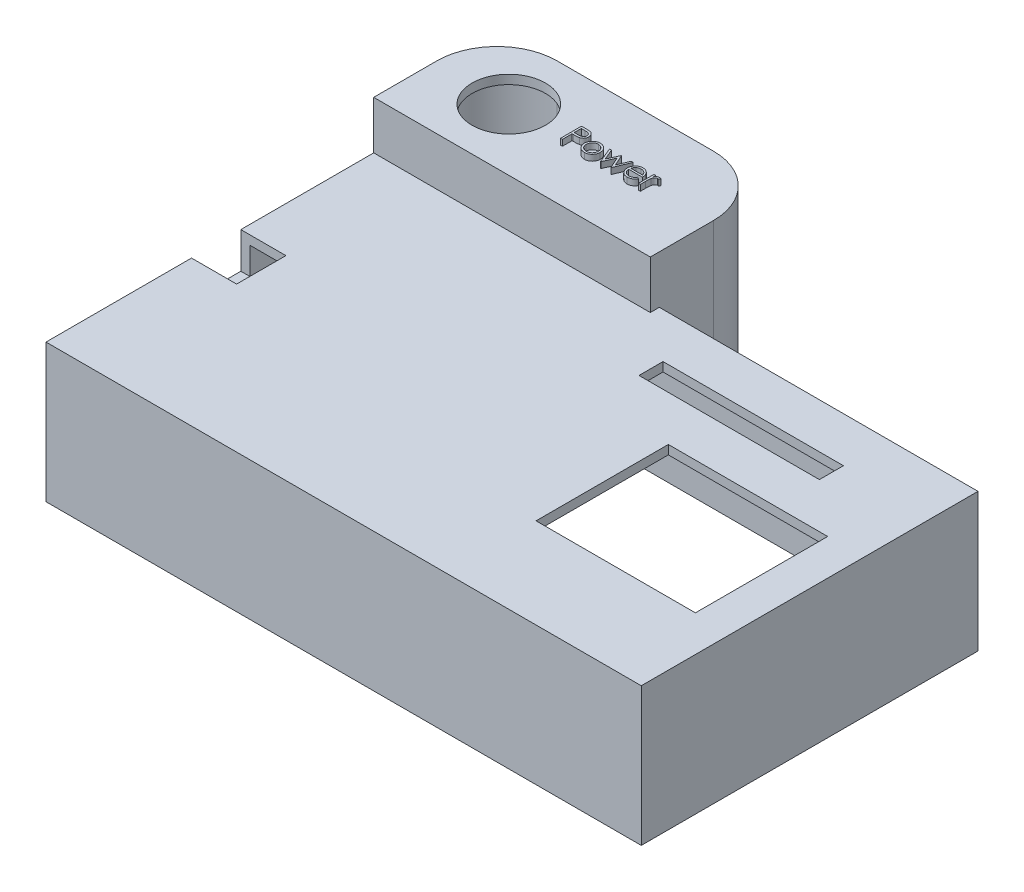
from build123d import *

# Parameters (mm, degrees)
SKETCH1_W           = 99
SKETCH1_H           = 56
BOSS_EXTRUDE1_DEPTH = 23
SKETCH3_W           = 96
SKETCH3_H           = 53
CUT_EXTRUDE1_DEPTH  = 21.5
SKETCH4_W           = 7.5
SKETCH4_H           = 8.2
CUT_EXTRUDE4_DEPTH  = 6
BOSS_EXTRUDE5_DEPTH = 31
CUT_EXTRUDE8_DEPTH  = 29.5
SKETCH16_W          = 37.752580564
SKETCH16_H          = 16
CUT_EXTRUDE10_DEPTH = 2
SKETCH17_R          = 6.1
CUT_EXTRUDE11_DEPTH = 2
BOSS_EXTRUDE6_DEPTH = 1
SKETCH19_W          = 26.5
SKETCH19_H          = 22
CUT_EXTRUDE12_DEPTH = 2
SKETCH20_W          = 30
SKETCH20_H          = 4
CUT_EXTRUDE13_DEPTH = 2


with BuildPart() as part:
    # Sketch1 → Boss-Extrude1 (new body)
    with BuildSketch(Plane(origin=(0, 0, 0), x_dir=(1, 0, 0), z_dir=(0, 1, 0))):
        Rectangle(SKETCH1_W, SKETCH1_H)
    extrude(amount=BOSS_EXTRUDE1_DEPTH)

    # Sketch3 → Cut-Extrude1 (cut)
    with BuildSketch(Plane.XZ):
        Rectangle(SKETCH3_W, SKETCH3_H)
    extrude(amount=-CUT_EXTRUDE1_DEPTH, mode=Mode.SUBTRACT)

    # Sketch4 → Cut-Extrude4 (cut)
    with BuildSketch(Plane(origin=(0, 23, 0), x_dir=(1, 0, 0), z_dir=(0, 1, 0))):
        with Locations((-45.75, 0.3)):
            Rectangle(SKETCH4_W, SKETCH4_H)
    extrude(amount=-CUT_EXTRUDE4_DEPTH, mode=Mode.SUBTRACT)

    # Sketch9 → Boss-Extrude5 (add)
    with BuildSketch(Plane.XZ):
        with BuildLine():
            Line((-3.5, -26.5), (-49.5, -26.5))
            Line((-49.5, -26.5), (-49.5, -37))
            ThreePointArc((-49.5, -37), (-46.571067812, -44.071067812), (-39.5, -47))
            Line((-39.5, -47), (-13.5, -47))
            ThreePointArc((-13.5, -47), (-6.428932188, -44.071067812), (-3.5, -37))
            Line((-3.5, -37), (-3.5, -26.5))
        make_face()
    extrude(amount=-BOSS_EXTRUDE5_DEPTH)

    # Sketch14 → Cut-Extrude8 (cut)
    with BuildSketch(Plane(origin=(0, 0, 0), x_dir=(-1, 0, 0), z_dir=(0, -1, 0))):
        with BuildLine():
            Line((5, 28), (48, 28))
            Line((48, 28), (48, 35.5))
            ThreePointArc((48, 35.5), (45.071067812, 42.571067812), (38, 45.5))
            Line((38, 45.5), (15, 45.5))
            ThreePointArc((15, 45.5), (7.928932188, 42.571067812), (5, 35.5))
            Line((5, 35.5), (5, 28))
        make_face()
    extrude(amount=-CUT_EXTRUDE8_DEPTH, mode=Mode.SUBTRACT)

    # Sketch16 → Cut-Extrude10 (cut)
    with BuildSketch(Plane.XY.offset(-26.5)):
        with Locations((-27.111178413, 12)):
            Rectangle(SKETCH16_W, SKETCH16_H)
    extrude(amount=-CUT_EXTRUDE10_DEPTH, mode=Mode.SUBTRACT)

    # Sketch17 → Cut-Extrude11 (cut)
    with BuildSketch(Plane(origin=(0, 29.5, 0), x_dir=(-1, 0, 0), z_dir=(0, -1, 0))):
        with Locations((37.281553398, 36.75)):
            Circle(SKETCH17_R)
    extrude(amount=-CUT_EXTRUDE11_DEPTH, mode=Mode.SUBTRACT)

    # Sketch18 → Boss-Extrude6 (add)
    # profile 1 of 5: a face of its own
    with BuildSketch(Plane(origin=(0, 31, 0), x_dir=(1, 0, 0), z_dir=(0, 1, 0))):
        with BuildLine():
            Line((-27.068619083, 38.631067961), (-26.382220846, 38.631067961))
            add(Edge.make_bspline(
                [(-26.382220846, 38.631067961), (-26.33500994, 38.631016065), (-26.244551747, 38.630916629), (-26.114836691, 38.627901884), (-25.99702696, 38.623875192), (-25.891376579, 38.618293298), (-25.797560481, 38.611696708), (-25.716003181, 38.602444669), (-25.646063625, 38.592784373), (-25.604157175, 38.582962967), (-25.585045365, 38.578483827)],
                knots=[0, 0, 0, 0, 1.415646017, 2.712440637, 3.8905458, 4.950247383, 5.884950622, 6.709939814, 7.411656543, 8, 8, 8, 8], degree=3))
            add(Edge.make_bspline(
                [(-25.585045365, 38.578483827), (-25.560851831, 38.571861877), (-25.513034854, 38.558774015), (-25.444133811, 38.532560292), (-25.378579966, 38.501478126), (-25.316148407, 38.466054187), (-25.257606324, 38.424768622), (-25.202080283, 38.379295005), (-25.150060303, 38.328583436), (-25.101838911, 38.273202696), (-25.057554113, 38.214082486), (-25.019424431, 38.150340256), (-24.987497204, 38.083048953), (-24.960113932, 38.012255382), (-24.940405478, 37.937365058), (-24.925558578, 37.858898346), (-24.91613495, 37.776863656), (-24.915232389, 37.720803788), (-24.914772929, 37.692265878)],
                knots=[0, 0, 0, 0, 0.999701418, 1.975846123, 2.934577507, 3.890451536, 4.834027766, 5.787354733, 6.749476667, 7.726910423, 8.712836071, 9.690891519, 10.682875813, 11.679750201, 12.712814741, 13.765529915, 14.8625177, 16, 16, 16, 16], degree=3))
            add(Edge.make_bspline(
                [(-24.914772929, 37.692265878), (-24.915194354, 37.663488101), (-24.9160189, 37.607182437), (-24.925915185, 37.524809649), (-24.939245377, 37.446091259), (-24.959742429, 37.371201808), (-24.986588102, 37.300586038), (-25.018080155, 37.233164806), (-25.056063686, 37.170085134), (-25.099708515, 37.111118016), (-25.14826011, 37.056208104), (-25.201513048, 37.00575331), (-25.25925234, 36.960048971), (-25.321294488, 36.918992627), (-25.388244337, 36.883536348), (-25.459086491, 36.851779043), (-25.534436707, 36.825107982), (-25.586579221, 36.811077921), (-25.613090237, 36.803944564)],
                knots=[0, 0, 0, 0, 1.121902311, 2.195077645, 3.232258892, 4.234102512, 5.217864754, 6.176164875, 7.132989551, 8.084763148, 9.034132444, 9.988522005, 10.94243251, 11.903244335, 12.886203696, 13.894208494, 14.929344452, 16, 16, 16, 16], degree=3))
            add(Edge.make_bspline(
                [(-25.613090237, 36.803944564), (-25.635017571, 36.799281583), (-25.683072598, 36.789062388), (-25.762215321, 36.777653932), (-25.854360706, 36.767916331), (-25.959382986, 36.760615193), (-26.077187891, 36.754364825), (-26.207839149, 36.749396731), (-26.351593226, 36.746666877), (-26.45186447, 36.746526084), (-26.504216038, 36.746452577)],
                knots=[0, 0, 0, 0, 0.601384939, 1.31797006, 2.144135048, 3.087295005, 4.142315834, 5.309527816, 6.595305764, 8, 8, 8, 8], degree=3))
            Line((-26.504216038, 36.746452577), (-26.754516519, 36.746452577))
            Line((-26.754516519, 36.746452577), (-26.754516519, 35.131067961))
            Line((-26.754516519, 35.131067961), (-27.068619083, 35.131067961))
            Line((-27.068619083, 35.131067961), (-27.068619083, 38.631067961))
        make_face()
        with BuildLine():
            Line((-26.754516519, 38.272093602), (-26.754516519, 37.105426936))
            Line((-26.754516519, 37.105426936), (-26.14173607, 37.097714596))
            add(Edge.make_bspline(
                [(-26.14173607, 37.097714596), (-26.111816145, 37.097699132), (-26.054056345, 37.09766928), (-25.970620121, 37.101654504), (-25.893210834, 37.106255036), (-25.822066259, 37.11299096), (-25.757154324, 37.122512217), (-25.698366795, 37.132123955), (-25.646159512, 37.146029318), (-25.585060311, 37.164752387), (-25.516976963, 37.196685002), (-25.442909415, 37.243034893), (-25.380138828, 37.302115601), (-25.325820532, 37.368543432), (-25.282714654, 37.442442561), (-25.251158661, 37.521511498), (-25.232617504, 37.604939348), (-25.23013131, 37.662027487), (-25.228875493, 37.690863634)],
                knots=[0, 0, 0, 0, 1.160613943, 2.240541288, 3.23993089, 4.169200891, 5.011653406, 5.7853311, 6.478053781, 7.106038997, 8.262395093, 9.384106736, 10.481365981, 11.59014053, 12.70357646, 13.786202915, 14.881775077, 16, 16, 16, 16], degree=3))
            add(Edge.make_bspline(
                [(-25.228875493, 37.690863634), (-25.23013814, 37.719002148), (-25.232648125, 37.77493803), (-25.251303988, 37.85691679), (-25.282653302, 37.935152495), (-25.326109896, 38.00812558), (-25.378851026, 38.074314384), (-25.44015037, 38.131811511), (-25.509863631, 38.178033214), (-25.574711862, 38.207866496), (-25.632313048, 38.226081771), (-25.682345008, 38.238826611), (-25.738835682, 38.249002218), (-25.801803462, 38.257241721), (-25.870760296, 38.264295182), (-25.946298611, 38.269081159), (-26.028132254, 38.271882615), (-26.084942825, 38.27202157), (-26.11439232, 38.272093602)],
                knots=[0, 0, 0, 0, 1.120700087, 2.227813068, 3.331159281, 4.466773991, 5.599788987, 6.693661531, 7.80175334, 8.91857717, 9.525282508, 10.207424825, 10.974604443, 11.810962634, 12.737642355, 13.736264703, 14.826523623, 16, 16, 16, 16], degree=3))
            Line((-26.11439232, 38.272093602), (-26.754516519, 38.272093602))
        make_face(mode=Mode.SUBTRACT)
    # profile 2 of 5: a face of its own
    with BuildSketch(Plane(origin=(0, 31, 0), x_dir=(1, 0, 0), z_dir=(0, 1, 0))):
        with BuildLine():
            add(Edge.make_bspline(
                [(-23.051191199, 37.733632064), (-23.003199926, 37.732610173), (-22.909100768, 37.730606494), (-22.771292882, 37.709191528), (-22.639747746, 37.676444164), (-22.513961554, 37.631172602), (-22.395545259, 37.570490651), (-22.282774015, 37.49808136), (-22.175957006, 37.412298766), (-22.111933976, 37.345940698), (-22.079436391, 37.312257865)],
                knots=[0, 0, 0, 0, 1.054011418, 2.066658804, 3.057071809, 4.030435133, 4.997543892, 5.974964718, 6.972108034, 8, 8, 8, 8], degree=3))
            add(Edge.make_bspline(
                [(-22.079436391, 37.312257865), (-22.051454437, 37.280043879), (-21.996032057, 37.216239337), (-21.924966338, 37.112783724), (-21.863744778, 37.005643623), (-21.814681817, 36.893396297), (-21.775996793, 36.777021626), (-21.748531097, 36.656119614), (-21.732194162, 36.530957267), (-21.729991195, 36.445953429), (-21.728875493, 36.402902897)],
                knots=[0, 0, 0, 0, 1.025258237, 2.030674902, 3.01204498, 3.988269485, 4.97094183, 5.956517959, 6.965070386, 8, 8, 8, 8], degree=3))
            add(Edge.make_bspline(
                [(-21.728875493, 36.402902897), (-21.729856831, 36.359602839), (-21.731795999, 36.274039906), (-21.750139615, 36.14802054), (-21.778670701, 36.025825718), (-21.81950254, 35.907967024), (-21.871860649, 35.794084196), (-21.935751336, 35.684674647), (-22.011622953, 35.579522514), (-22.09762695, 35.479520676), (-22.192678826, 35.387354461), (-22.295794975, 35.307026191), (-22.404949008, 35.238204667), (-22.521592362, 35.182768251), (-22.644659849, 35.139058551), (-22.774416917, 35.108358535), (-22.910661987, 35.089796851), (-23.003689208, 35.087413278), (-23.051191199, 35.086196166)],
                knots=[0, 0, 0, 0, 0.998656419, 1.973391657, 2.932242238, 3.890759089, 4.846373663, 5.82037756, 6.809684879, 7.83454468, 8.860553229, 9.859544525, 10.845671541, 11.83227036, 12.833544569, 13.85385346, 14.904124723, 16, 16, 16, 16], degree=3))
            add(Edge.make_bspline(
                [(-23.051191199, 35.086196166), (-23.098925918, 35.087417363), (-23.192416778, 35.089809137), (-23.32914276, 35.10828642), (-23.459132379, 35.139044402), (-23.582360977, 35.182911895), (-23.699505824, 35.238206439), (-23.809292321, 35.306818128), (-23.912492237, 35.387378284), (-24.007564221, 35.479514221), (-24.093562826, 35.579524177), (-24.169435835, 35.684674215), (-24.233326161, 35.794084309), (-24.285684365, 35.907966994), (-24.326516178, 36.025825726), (-24.35504727, 36.148020538), (-24.373390885, 36.274039907), (-24.375330053, 36.35960284), (-24.376311391, 36.402902897)],
                knots=[0, 0, 0, 0, 1.099876186, 2.154163076, 3.173186993, 4.173200201, 5.163417411, 6.152872554, 7.150605724, 8.17532212, 9.198891216, 10.186952605, 11.159729845, 12.11414092, 13.071450619, 14.029093627, 15.002601286, 16, 16, 16, 16], degree=3))
            add(Edge.make_bspline(
                [(-24.376311391, 36.402902897), (-24.375188081, 36.445719443), (-24.372964119, 36.530488845), (-24.35664361, 36.655415906), (-24.329285054, 36.776113295), (-24.290553657, 36.892038771), (-24.241038466, 37.003794207), (-24.180677178, 37.111199038), (-24.108886546, 37.214186839), (-24.053684594, 37.277908919), (-24.025750493, 37.3101545)],
                knots=[0, 0, 0, 0, 1.031353054, 2.041901799, 3.029428768, 4.008703097, 4.981709435, 5.96992636, 6.972712378, 8, 8, 8, 8], degree=3))
            add(Edge.make_bspline(
                [(-24.025750493, 37.3101545), (-23.993301902, 37.344129439), (-23.929486039, 37.410947135), (-23.822137311, 37.496479659), (-23.70964349, 37.570395733), (-23.589918564, 37.629871948), (-23.464235706, 37.676710466), (-23.332016463, 37.709275981), (-23.193740948, 37.730529336), (-23.099181327, 37.732587514), (-23.051191199, 37.733632064)],
                knots=[0, 0, 0, 0, 1.027980169, 2.021703884, 2.998553061, 3.971491411, 4.943284454, 5.930300938, 6.949603206, 8, 8, 8, 8], degree=3))
        make_face()
        with BuildLine():
            add(Edge.make_bspline(
                [(-23.052593442, 37.4195295), (-23.086531053, 37.418564908), (-23.153530182, 37.416660625), (-23.252149767, 37.402176721), (-23.347089921, 37.379229217), (-23.438530765, 37.34662516), (-23.526163937, 37.304526261), (-23.61007334, 37.252817901), (-23.69050578, 37.192184945), (-23.765887843, 37.122722273), (-23.835070155, 37.046843279), (-23.895548132, 36.96599492), (-23.946973238, 36.881488573), (-23.989813397, 36.793236362), (-24.021720585, 36.700343948), (-24.044893608, 36.603863317), (-24.059363848, 36.503597901), (-24.061250227, 36.435436882), (-24.062208827, 36.400799532)],
                knots=[0, 0, 0, 0, 1.021534396, 2.016698045, 2.994645724, 3.958388632, 4.93408049, 5.916473867, 6.921342795, 7.962252576, 8.998418191, 10.008913653, 10.997312074, 11.973003931, 12.956656626, 13.948281152, 14.957379055, 16, 16, 16, 16], degree=3))
            add(Edge.make_bspline(
                [(-24.062208827, 36.400799532), (-24.060602003, 36.356047505), (-24.057412759, 36.267223099), (-24.031477522, 36.136411976), (-23.988091242, 36.010830124), (-23.929503963, 35.891213738), (-23.856097744, 35.78054146), (-23.769610677, 35.681869976), (-23.670970977, 35.596684164), (-23.561354477, 35.526003319), (-23.443000159, 35.469843563), (-23.317743838, 35.430044587), (-23.187103144, 35.404172895), (-23.097822413, 35.401601421), (-23.052593442, 35.40029873)],
                knots=[0, 0, 0, 0, 1.016792936, 2.018143844, 3.017858371, 4.030088057, 5.03801393, 6.028138512, 7.003788237, 7.991172063, 8.984598303, 9.972568034, 10.972917682, 12, 12, 12, 12], degree=3))
            add(Edge.make_bspline(
                [(-23.052593442, 35.40029873), (-23.007367073, 35.401609011), (-22.918091477, 35.404195468), (-22.7876323, 35.429914287), (-22.662718329, 35.470017948), (-22.544486941, 35.525940158), (-22.434920338, 35.596952573), (-22.335571216, 35.68138895), (-22.249822605, 35.780802801), (-22.176489, 35.89136033), (-22.116942258, 36.010644682), (-22.073759056, 36.136435154), (-22.04776147, 36.267217196), (-22.044580641, 36.356045527), (-22.042978058, 36.400799532)],
                knots=[0, 0, 0, 0, 1.02726834, 2.027799167, 3.010890988, 4.004497153, 4.992059811, 5.971914811, 6.958719428, 7.966827853, 8.981595046, 9.981490638, 10.983022906, 12, 12, 12, 12], degree=3))
            add(Edge.make_bspline(
                [(-22.042978058, 36.400799532), (-22.043936328, 36.435437089), (-22.045822057, 36.503598515), (-22.060297021, 36.603860969), (-22.083452561, 36.700352565), (-22.115424178, 36.793204569), (-22.158078192, 36.881717073), (-22.210494985, 36.9657468), (-22.27072601, 37.047123346), (-22.340743131, 37.122476987), (-22.416046509, 37.192212023), (-22.496511547, 37.252841413), (-22.580296526, 37.304299008), (-22.667675109, 37.346985249), (-22.759127676, 37.378932589), (-22.853934805, 37.402309221), (-22.952133615, 37.416599417), (-23.018892658, 37.418546559), (-23.052593442, 37.4195295)],
                knots=[0, 0, 0, 0, 1.042956736, 2.052379634, 3.044323526, 4.02829302, 5.004299113, 5.996692471, 7.007513377, 8.048758398, 9.090003419, 10.095195979, 11.07790575, 12.047570684, 13.018257071, 13.989683339, 14.985167495, 16, 16, 16, 16], degree=3))
        make_face(mode=Mode.SUBTRACT)
    # profile 3 of 5: a face of its own
    with BuildSketch(Plane(origin=(0, 31, 0), x_dir=(1, 0, 0), z_dir=(0, 1, 0))):
        Polygon((-21.459644724, 37.688760269), (-21.123106263, 37.688760269), (-20.36028575, 35.849016679), (-19.526651936, 37.688760269), (-19.472665558, 37.688760269), (-18.655157545, 35.849016679), (-17.886026936, 37.688760269), (-17.55579857, 37.688760269), (-18.625009308, 35.131067961), (-18.689512513, 35.131067961), (-19.507721647, 36.970811551), (-20.341355461, 35.131067961), (-20.398847449, 35.131067961), align=None)
    # profile 4 of 5: a face of its own
    with BuildSketch(Plane(origin=(0, 31, 0), x_dir=(1, 0, 0), z_dir=(0, 1, 0))):
        with BuildLine():
            Line((-15.052793763, 35.938760269), (-14.773747288, 35.792225814))
            add(Edge.make_bspline(
                [(-14.773747288, 35.792225814), (-14.795983884, 35.752782482), (-14.839247492, 35.67604138), (-14.91364824, 35.570609519), (-14.991640313, 35.475761803), (-15.076744281, 35.394032149), (-15.166413959, 35.322780764), (-15.261146614, 35.260442939), (-15.361435432, 35.207324419), (-15.467285157, 35.162571891), (-15.579584708, 35.128162397), (-15.698606224, 35.103858176), (-15.82457772, 35.088834907), (-15.9109239, 35.087089767), (-15.955137513, 35.086196166)],
                knots=[0, 0, 0, 0, 1.120438281, 2.179929193, 3.190490725, 4.156257408, 5.095198341, 6.022838206, 6.959905092, 7.901321166, 8.864066838, 9.862729781, 10.905609505, 12, 12, 12, 12], degree=3))
            add(Edge.make_bspline(
                [(-15.955137513, 35.086196166), (-16.00427949, 35.087343342), (-16.100141252, 35.089581148), (-16.239680999, 35.108873613), (-16.371060417, 35.140345971), (-16.494272121, 35.184311513), (-16.609014373, 35.241738837), (-16.715515228, 35.311698319), (-16.814334754, 35.393830574), (-16.902358963, 35.488847017), (-16.981602846, 35.590528974), (-17.051528666, 35.696484859), (-17.109986097, 35.806448083), (-17.157538707, 35.919718607), (-17.195943572, 36.035582501), (-17.222710276, 36.155093968), (-17.238140024, 36.277929553), (-17.240504469, 36.361026888), (-17.241696006, 36.402902897)],
                knots=[0, 0, 0, 0, 1.145258523, 2.234067595, 3.276747158, 4.290159414, 5.277019952, 6.260822364, 7.254936242, 8.264827045, 9.274100331, 10.257902744, 11.220704747, 12.172965371, 13.118907548, 14.062713208, 15.023725156, 16, 16, 16, 16], degree=3))
            add(Edge.make_bspline(
                [(-17.241696006, 36.402902897), (-17.240636865, 36.442197727), (-17.238537787, 36.520074892), (-17.225306999, 36.635340437), (-17.201858706, 36.747368889), (-17.169682382, 36.856253337), (-17.128131136, 36.961811471), (-17.077298917, 37.064107535), (-17.017106539, 37.163032675), (-16.970633865, 37.225435808), (-16.947224852, 37.256869243)],
                knots=[0, 0, 0, 0, 1.024358464, 2.0301432, 3.019427413, 4.004406732, 4.986367066, 5.972626655, 6.978780325, 8, 8, 8, 8], degree=3))
            add(Edge.make_bspline(
                [(-16.947224852, 37.256869243), (-16.91551717, 37.294738113), (-16.853106223, 37.369276264), (-16.747549868, 37.46721459), (-16.633249671, 37.549258365), (-16.511638045, 37.617265501), (-16.381301571, 37.668939148), (-16.24399228, 37.70744673), (-16.098146694, 37.729024741), (-15.998441473, 37.732072575), (-15.947425173, 37.733632064)],
                knots=[0, 0, 0, 0, 1.030682036, 2.02871468, 2.997146059, 3.962720338, 4.930598197, 5.918074684, 6.934738563, 8, 8, 8, 8], degree=3))
            add(Edge.make_bspline(
                [(-15.947425173, 37.733632064), (-15.894977568, 37.732278015), (-15.792087322, 37.72962168), (-15.642055201, 37.704995346), (-15.500094484, 37.665942792), (-15.36626198, 37.610789001), (-15.240544119, 37.539629449), (-15.123758069, 37.451487608), (-15.013906557, 37.349069521), (-14.949997978, 37.270306311), (-14.917477256, 37.230226615)],
                knots=[0, 0, 0, 0, 1.056321875, 2.072262726, 3.055038591, 4.01806755, 4.982017516, 5.957941055, 6.960871419, 8, 8, 8, 8], degree=3))
            add(Edge.make_bspline(
                [(-14.917477256, 37.230226615), (-14.895350318, 37.200023034), (-14.851243725, 37.139816915), (-14.795996625, 37.041645758), (-14.74803923, 36.938935163), (-14.709706269, 36.830024866), (-14.678666768, 36.716205286), (-14.656209949, 36.596662742), (-14.64304033, 36.47143283), (-14.640451633, 36.386106275), (-14.639131904, 36.342606423)],
                knots=[0, 0, 0, 0, 0.94817472, 1.890038105, 2.849395472, 3.817997239, 4.812318967, 5.836947057, 6.897266129, 8, 8, 8, 8], degree=3))
            Line((-14.639131904, 36.342606423), (-16.927593442, 36.342606423))
            add(Edge.make_bspline(
                [(-16.927593442, 36.342606423), (-16.926053836, 36.308905958), (-16.923026262, 36.242635355), (-16.908911119, 36.145664572), (-16.886662345, 36.053291229), (-16.855393282, 35.966208187), (-16.817526437, 35.88327806), (-16.77114072, 35.805116023), (-16.715801166, 35.732078093), (-16.654075467, 35.663510955), (-16.585368371, 35.602450194), (-16.513085624, 35.547798418), (-16.436192059, 35.501992821), (-16.355293976, 35.464812931), (-16.270522191, 35.435706615), (-16.181849996, 35.415838795), (-16.089451879, 35.402531688), (-16.026466145, 35.401052023), (-15.994400333, 35.40029873)],
                knots=[0, 0, 0, 0, 1.094153842, 2.151609401, 3.174256925, 4.172055639, 5.149267565, 6.128595816, 7.11444997, 8.118368179, 9.117203808, 10.09244225, 11.054858984, 12.015122123, 12.976791628, 13.957293641, 14.960065497, 16, 16, 16, 16], degree=3))
            add(Edge.make_bspline(
                [(-15.994400333, 35.40029873), (-15.963049186, 35.400906787), (-15.900842495, 35.402113288), (-15.808201637, 35.413845199), (-15.71706211, 35.432815475), (-15.627801127, 35.458705465), (-15.542230281, 35.490282317), (-15.462984731, 35.528385174), (-15.390104515, 35.570534921), (-15.321987548, 35.618744596), (-15.255916555, 35.677752783), (-15.190374069, 35.751388504), (-15.120097415, 35.838476032), (-15.076107823, 35.904021698), (-15.052793763, 35.938760269)],
                knots=[0, 0, 0, 0, 0.99110716, 1.966546729, 2.947904876, 3.932708344, 4.903319531, 5.828989031, 6.710028674, 7.56322171, 8.463672341, 9.504779593, 10.677557249, 12, 12, 12, 12], degree=3))
        make_face()
        with BuildLine():
            add(Edge.make_bspline(
                [(-14.953234468, 36.656708987), (-14.964731092, 36.698371861), (-14.986858394, 36.778559481), (-15.033094758, 36.889600372), (-15.085166299, 36.988288273), (-15.14678803, 37.073867906), (-15.216606756, 37.149871419), (-15.297251939, 37.216290004), (-15.387687832, 37.275707455), (-15.487446973, 37.325859954), (-15.593088758, 37.368549813), (-15.70369495, 37.397174929), (-15.816552738, 37.416784471), (-15.892887024, 37.41861058), (-15.931299372, 37.4195295)],
                knots=[0, 0, 0, 0, 1.154881502, 2.222775134, 3.210006277, 4.132804581, 5.035138423, 5.962687519, 6.919655026, 7.923214229, 8.944639381, 9.960483929, 10.97369054, 12, 12, 12, 12], degree=3))
            add(Edge.make_bspline(
                [(-15.931299372, 37.4195295), (-15.96264881, 37.418917828), (-16.024620059, 37.417708682), (-16.115921127, 37.406238553), (-16.203600826, 37.387278708), (-16.288306114, 37.361313751), (-16.368926982, 37.326705149), (-16.447121751, 37.286121922), (-16.520902147, 37.236580338), (-16.567043442, 37.198821483), (-16.590353859, 37.179745846)],
                knots=[0, 0, 0, 0, 1.04873581, 2.073130211, 3.073294108, 4.04793562, 5.032784715, 6.005352987, 6.992311501, 8, 8, 8, 8], degree=3))
            add(Edge.make_bspline(
                [(-16.590353859, 37.179745846), (-16.607047141, 37.16465153), (-16.640830275, 37.134104314), (-16.685970797, 37.081475108), (-16.729191269, 37.024723545), (-16.768524922, 36.961678421), (-16.804602508, 36.893057642), (-16.838362486, 36.819440007), (-16.868748898, 36.740266876), (-16.885845008, 36.685094437), (-16.894640718, 36.656708987)],
                knots=[0, 0, 0, 0, 0.879870761, 1.780643979, 2.707998968, 3.669668524, 4.684282772, 5.740141944, 6.837334558, 8, 8, 8, 8], degree=3))
            Line((-16.894640718, 36.656708987), (-14.953234468, 36.656708987))
        make_face(mode=Mode.SUBTRACT)
    # profile 5 of 5: a face of its own
    with BuildSketch(Plane(origin=(0, 31, 0), x_dir=(1, 0, 0), z_dir=(0, 1, 0))):
        with BuildLine():
            Line((-14.100670365, 37.688760269), (-13.786567801, 37.688760269))
            Line((-13.786567801, 37.688760269), (-13.786567801, 37.312257865))
            add(Edge.make_bspline(
                [(-13.786567801, 37.312257865), (-13.763379042, 37.347313693), (-13.719030721, 37.414357693), (-13.645317792, 37.503026994), (-13.569814461, 37.57644204), (-13.492159274, 37.634945559), (-13.411781174, 37.678758678), (-13.330444222, 37.710851713), (-13.246868752, 37.729829028), (-13.190706828, 37.732362687), (-13.162569404, 37.733632064)],
                knots=[0, 0, 0, 0, 1.2804753, 2.448899062, 3.506932113, 4.484331642, 5.4025378, 6.288909075, 7.142734305, 8, 8, 8, 8], degree=3))
            add(Edge.make_bspline(
                [(-13.162569404, 37.733632064), (-13.140743077, 37.732441537), (-13.095833992, 37.729991951), (-13.027851402, 37.712781127), (-12.95780795, 37.685303104), (-12.912665563, 37.659462881), (-12.889131904, 37.645991839)],
                knots=[0, 0, 0, 0, 0.901110191, 1.854092781, 2.881294221, 4, 4, 4, 4], degree=3))
            Line((-12.889131904, 37.645991839), (-13.061607865, 37.373956583))
            add(Edge.make_bspline(
                [(-13.061607865, 37.373956583), (-13.076716886, 37.380696849), (-13.105396701, 37.393491164), (-13.147351267, 37.408633175), (-13.186032604, 37.41754909), (-13.210676162, 37.418899808), (-13.222164756, 37.4195295)],
                knots=[0, 0, 0, 0, 1.180555205, 2.24091978, 3.179933427, 4, 4, 4, 4], degree=3))
            add(Edge.make_bspline(
                [(-13.222164756, 37.4195295), (-13.24737049, 37.417849462), (-13.29878288, 37.414422673), (-13.374267379, 37.387483865), (-13.447514585, 37.343958625), (-13.505686247, 37.295687513), (-13.5507285, 37.249139716), (-13.582868725, 37.208491313), (-13.612351472, 37.162912682), (-13.640521693, 37.113182998), (-13.666187987, 37.058453152), (-13.690142656, 36.999269938), (-13.711801519, 36.93556481), (-13.724151763, 36.891182289), (-13.730478058, 36.868447769)],
                knots=[0, 0, 0, 0, 1.125678352, 2.296057538, 3.5422874, 4.923748041, 5.663163013, 6.437101912, 7.23742474, 8.08941207, 8.991984279, 9.93940061, 10.944477711, 12, 12, 12, 12], degree=3))
            add(Edge.make_bspline(
                [(-13.730478058, 36.868447769), (-13.735210451, 36.848170595), (-13.745692343, 36.803258197), (-13.75588388, 36.727909672), (-13.765953398, 36.638886013), (-13.773050017, 36.53593942), (-13.779628059, 36.419326976), (-13.783338141, 36.288871031), (-13.786441282, 36.14443768), (-13.786524349, 36.043463326), (-13.786567801, 35.990643282)],
                knots=[0, 0, 0, 0, 0.566838948, 1.255505196, 2.06880316, 3.007127437, 4.065329342, 5.249902469, 6.561414163, 8, 8, 8, 8], degree=3))
            Line((-13.786567801, 35.990643282), (-13.786567801, 35.131067961))
            Line((-13.786567801, 35.131067961), (-14.100670365, 35.131067961))
            Line((-14.100670365, 35.131067961), (-14.100670365, 37.688760269))
        make_face()
    extrude(amount=BOSS_EXTRUDE6_DEPTH)

    # Sketch19 → Cut-Extrude12 (cut)
    with BuildSketch(Plane(origin=(0, 23, 0), x_dir=(1, 0, 0), z_dir=(0, 1, 0))):
        with Locations((30.25, -2)):
            Rectangle(SKETCH19_W, SKETCH19_H)
    extrude(amount=-CUT_EXTRUDE12_DEPTH, mode=Mode.SUBTRACT)

    # Sketch20 → Cut-Extrude13 (cut)
    with BuildSketch(Plane(origin=(0, 23, 0), x_dir=(1, 0, 0), z_dir=(0, 1, 0))):
        with Locations((19.618585298, 18.5)):
            Rectangle(SKETCH20_W, SKETCH20_H)
    extrude(amount=-CUT_EXTRUDE13_DEPTH, mode=Mode.SUBTRACT)


solid = part.part
